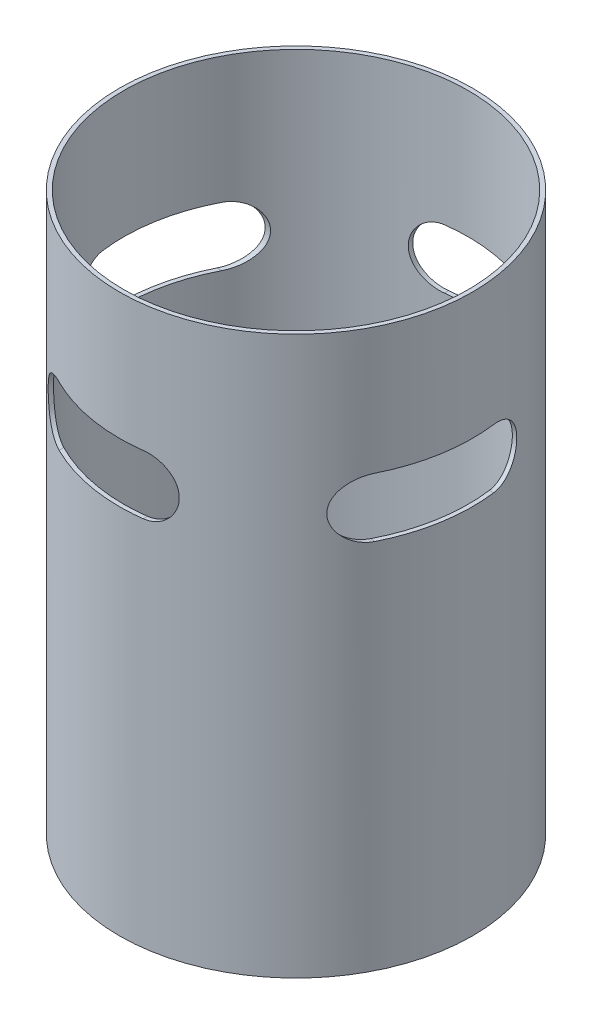
from build123d import *

# Parameters (mm, degrees)
SKETCH2_R           = 20.9
SKETCH2_R_2         = 20.4
BOSS_EXTRUDE1_DEPTH = 66
SKETCH3_R           = 20.848686735
BOSS_EXTRUDE2_DEPTH = 0.1
SKETCH4_R           = 8.6
BOSS_EXTRUDE3_DEPTH = 3.5
SKETCH5_R           = 2.4
BOSS_EXTRUDE4_DEPTH = 1.35
SKETCH7_R           = 2.4
CUT_EXTRUDE1_DEPTH  = 76.523969705
CUT_EXTRUDE6_DEPTH  = 73.316111621
CIRPATTERN2_COUNT   = 4


with BuildPart() as part:
    # Sketch2 → Boss-Extrude1 (new body)
    with BuildSketch(Plane(origin=(0, 0, 0), x_dir=(1, 0, 0), z_dir=(0, 1, 0))):
        Circle(SKETCH2_R)
        Circle(SKETCH2_R_2, mode=Mode.SUBTRACT)
    extrude(amount=BOSS_EXTRUDE1_DEPTH)

    # Sketch3 → Boss-Extrude2 (add)
    with BuildSketch(Plane(origin=(0, 0, 0), x_dir=(1, 0, 0), z_dir=(0, 1, 0))):
        Circle(SKETCH3_R)
    extrude(amount=BOSS_EXTRUDE2_DEPTH)

    # Sketch4 → Boss-Extrude3 (add)
    with BuildSketch(Plane(origin=(0, 0, 0), x_dir=(1, 0, 0), z_dir=(0, 1, 0))):
        with Locations((0.271248052, 0)):
            Circle(SKETCH4_R)
    extrude(amount=-BOSS_EXTRUDE3_DEPTH)

    # Sketch5 → Boss-Extrude4 (add)
    with BuildSketch(Plane.XZ.offset(3.5)):
        with Locations((0.36166407, 0)):
            Circle(SKETCH5_R)
    extrude(amount=-BOSS_EXTRUDE4_DEPTH)

    # Sketch7 → Cut-Extrude1 (cut, through all)
    with BuildSketch(Plane.XZ.offset(3.5)):
        with Locations((0.271248052, 0)):
            Circle(SKETCH7_R)
    extrude(amount=-CUT_EXTRUDE1_DEPTH, mode=Mode.SUBTRACT)

    # Sketch15 → Cut-Extrude6 (cut, through all)
    with BuildSketch(Plane(origin=(0, 0, 0), x_dir=(0, 0, -1), z_dir=(1, 0, 0))):
        with BuildLine():
            Line((-2.657246102, 51), (9.342753898, 51))
            ThreePointArc((9.342753898, 51), (12.842753898, 47.5), (9.342753898, 44))
            Line((9.342753898, 44), (-2.657246102, 44))
            ThreePointArc((-2.657246102, 44), (-6.157246102, 47.5), (-2.657246102, 51))
        make_face()
    cut_extrude6 = extrude(amount=-CUT_EXTRUDE6_DEPTH, mode=Mode.SUBTRACT)

    # CirPattern2: Cut-Extrude6 ×4 about axis
    cirpattern2_axis = Axis((0, 66, 0), (0, -1, 0))
    for i in range(1, CIRPATTERN2_COUNT):
        add(cut_extrude6.rotate(cirpattern2_axis, i * 360 / CIRPATTERN2_COUNT), mode=Mode.SUBTRACT)


solid = part.part
